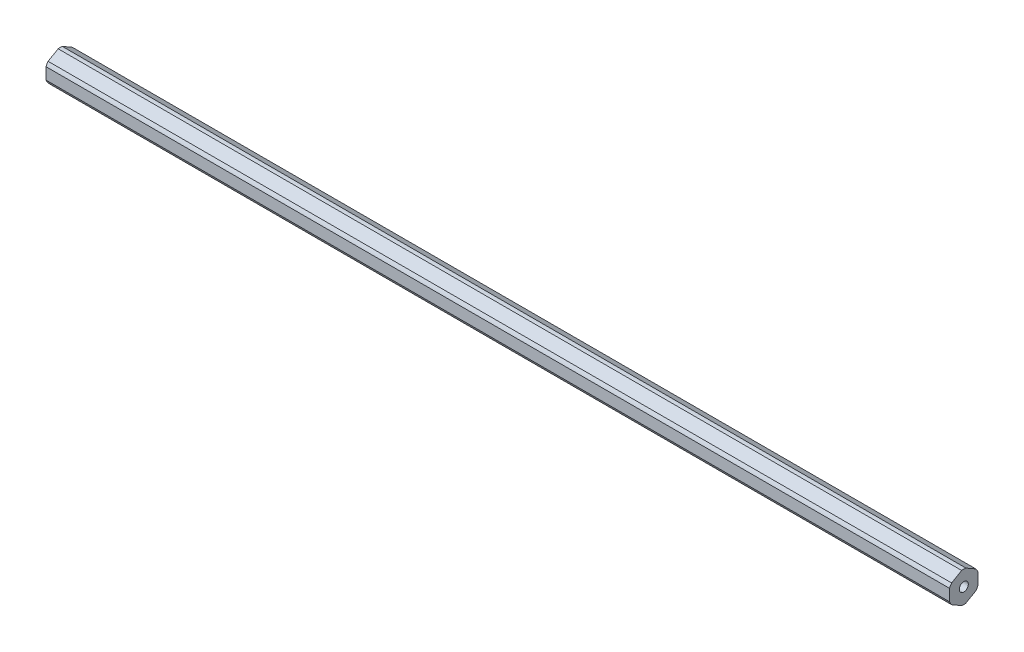
from build123d import *

# Parameters (mm, degrees)
BOSS_EXTRUDE1_DEPTH                  = 201.58075
F_10_32_TAPPED_HOLE1_D               = 4.0386
F_10_32_TAPPED_HOLE1_DEPTH           = 12.02944
F_10_32_TAPPED_HOLE1_TIP             = 1.213317848
F_10_32_TAPPED_HOLE1_ON_FACE_2_D     = 4.0386
F_10_32_TAPPED_HOLE1_ON_FACE_2_DEPTH = 12.02944
F_10_32_TAPPED_HOLE1_ON_FACE_2_TIP   = 1.213317848


with BuildPart() as part:
    # Sketch1 → Boss-Extrude1 (new, symmetric)
    with BuildSketch(Plane(origin=(0, 0, 0), x_dir=(0, 0, -1), z_dir=(1, 0, 0))):
        with BuildLine():
            ThreePointArc((0.93173274, 6.79441227), (0, 6.858), (-0.93173274, 6.79441227))
            Line((-0.93173274, 6.79441227), (-5.41826726, 4.204110358))
            ThreePointArc((-5.41826726, 4.204110358), (-5.939202219, 3.429), (-6.35, 2.590301913))
            Line((-6.35, 2.590301913), (-6.35, -2.590301913))
            ThreePointArc((-6.35, -2.590301913), (-5.939202219, -3.429), (-5.41826726, -4.204110358))
            Line((-5.41826726, -4.204110358), (-0.93173274, -6.79441227))
            ThreePointArc((-0.93173274, -6.79441227), (0, -6.858), (0.93173274, -6.79441227))
            Line((0.93173274, -6.79441227), (5.41826726, -4.204110358))
            ThreePointArc((5.41826726, -4.204110358), (5.939202219, -3.429), (6.35, -2.590301913))
            Line((6.35, -2.590301913), (6.35, 2.590301913))
            ThreePointArc((6.35, 2.590301913), (5.939202219, 3.429), (5.41826726, 4.204110358))
            Line((5.41826726, 4.204110358), (0.93173274, 6.79441227))
        make_face()
    extrude(amount=BOSS_EXTRUDE1_DEPTH, both=True)

    # #10-32 Tapped Hole1
    with Locations(Plane(origin=(201.58075, 0, 0), x_dir=(0, 0, 1), z_dir=(1, 0, 0))):
        with Locations((0, 0)):
            Hole(F_10_32_TAPPED_HOLE1_D / 2, depth=F_10_32_TAPPED_HOLE1_DEPTH)
            with Locations((0, 0, -(F_10_32_TAPPED_HOLE1_DEPTH + F_10_32_TAPPED_HOLE1_TIP / 2))):  # 118° drill point
                Cone(0, F_10_32_TAPPED_HOLE1_D / 2, F_10_32_TAPPED_HOLE1_TIP, mode=Mode.SUBTRACT)

    # #10-32 Tapped Hole1 on face 2
    with Locations(Plane(origin=(-201.58075, 0, 0), x_dir=(0, 0, -1), z_dir=(-1, 0, 0))):
        with Locations((0, 0)):
            Hole(F_10_32_TAPPED_HOLE1_ON_FACE_2_D / 2, depth=F_10_32_TAPPED_HOLE1_ON_FACE_2_DEPTH)
            with Locations((0, 0, -(F_10_32_TAPPED_HOLE1_ON_FACE_2_DEPTH + F_10_32_TAPPED_HOLE1_ON_FACE_2_TIP / 2))):  # 118° drill point
                Cone(0, F_10_32_TAPPED_HOLE1_ON_FACE_2_D / 2, F_10_32_TAPPED_HOLE1_ON_FACE_2_TIP, mode=Mode.SUBTRACT)


solid = part.part
